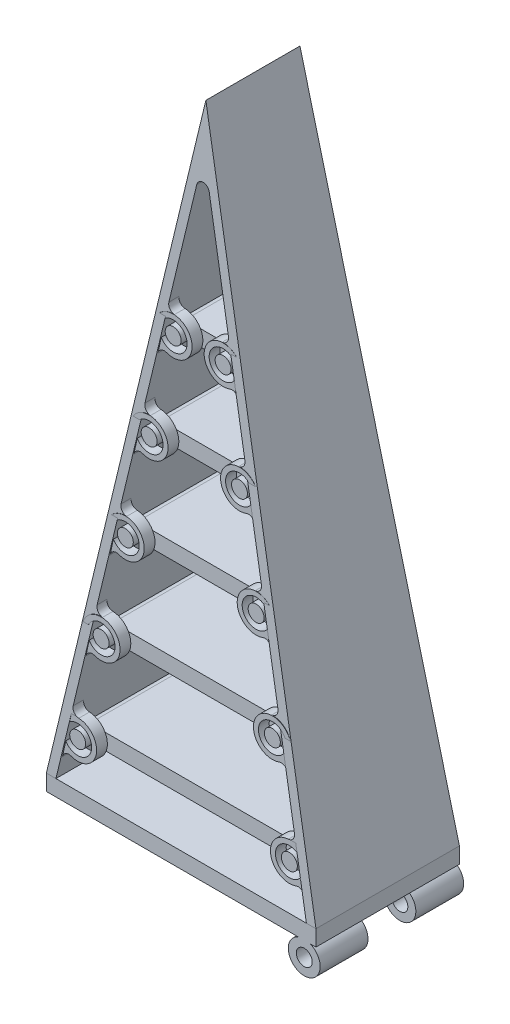
from build123d import *
from build123d.topology import SkipClean

# Parameters (mm, degrees)
AUFSATZ_LINEAR_AUSTRAGEN4_DEPTH      = 18
SCHNITT_LINEAR_AUSTRAGEN1_DEPTH      = 89.73537072
AUFSATZ_LINEAR_AUSTRAGEN5_DEPTH      = 5.37
AUFSATZ_LINEAR_AUSTRAGEN5_DEPTH_BACK = 5.37
AUFSATZ_LINEAR_AUSTRAGEN6_DEPTH      = 5.85
AUFSATZ_LINEAR_AUSTRAGEN6_DEPTH_BACK = 5.85
AUFSATZ_LINEAR_AUSTRAGEN7_DEPTH      = 6.3
AUFSATZ_LINEAR_AUSTRAGEN7_DEPTH_BACK = 6.3
AUFSATZ_LINEAR_AUSTRAGEN8_DEPTH      = 6.8
AUFSATZ_LINEAR_AUSTRAGEN8_DEPTH_BACK = 6.8
AUFSATZ_LINEAR_AUSTRAGEN9_DEPTH      = 7.2
AUFSATZ_LINEAR_AUSTRAGEN9_DEPTH_BACK = 7.2
SKIZZE13_R                           = 1
AUFSATZ_LINEAR_AUSTRAGEN12_DEPTH     = 1.5
SKIZZE14_R                           = 1
AUFSATZ_LINEAR_AUSTRAGEN13_DEPTH     = 1.5
SKIZZE15_R                           = 1
AUFSATZ_LINEAR_AUSTRAGEN14_DEPTH     = 1.5
SKIZZE16_R                           = 1
AUFSATZ_LINEAR_AUSTRAGEN15_DEPTH     = 1.5
SKIZZE17_R                           = 1
AUFSATZ_LINEAR_AUSTRAGEN16_DEPTH     = 1.5
SKIZZE18_R                           = 1
AUFSATZ_LINEAR_AUSTRAGEN17_DEPTH     = 1.5
SKIZZE19_R                           = 1
AUFSATZ_LINEAR_AUSTRAGEN18_DEPTH     = 1.5
SKIZZE20_R                           = 1
AUFSATZ_LINEAR_AUSTRAGEN19_DEPTH     = 1.5
SKIZZE21_R                           = 1
AUFSATZ_LINEAR_AUSTRAGEN20_DEPTH     = 1.5
SKIZZE22_R                           = 1
AUFSATZ_LINEAR_AUSTRAGEN21_DEPTH     = 1.5
SKIZZE24_R                           = 2.375
SKIZZE24_R_2                         = 1.75
AUFSATZ_LINEAR_AUSTRAGEN22_DEPTH     = 1.35
SKIZZE25_R                           = 2.375
SKIZZE25_R_2                         = 1.75
AUFSATZ_LINEAR_AUSTRAGEN23_DEPTH     = 1.35
SKIZZE26_R                           = 2.375
SKIZZE26_R_2                         = 1.75
AUFSATZ_LINEAR_AUSTRAGEN24_DEPTH     = 1.35
SKIZZE27_R                           = 2.375
SKIZZE27_R_2                         = 1.75
AUFSATZ_LINEAR_AUSTRAGEN25_DEPTH     = 1.35
SKIZZE28_R                           = 2.375
SKIZZE28_R_2                         = 1.75
AUFSATZ_LINEAR_AUSTRAGEN26_DEPTH     = 1.35
AUFSATZ_LINEAR_START                 = -1.35
SKIZZE29_R                           = 2.375
SKIZZE29_R_2                         = 1.75
AUFSATZ_LINEAR_AUSTRAGEN27_DEPTH     = 1.35
SKIZZE30_R                           = 2.375
SKIZZE30_R_2                         = 1.75
AUFSATZ_LINEAR_AUSTRAGEN28_DEPTH     = 1.35
SKIZZE31_R                           = 2.375
SKIZZE31_R_2                         = 1.75
AUFSATZ_LINEAR_AUSTRAGEN29_DEPTH     = 1.35
SKIZZE32_R                           = 2.375
SKIZZE32_R_2                         = 1.75
AUFSATZ_LINEAR_AUSTRAGEN30_DEPTH     = 1.35
SKIZZE33_R                           = 2.375
SKIZZE33_R_2                         = 1.75
AUFSATZ_LINEAR_AUSTRAGEN31_DEPTH     = 1.35
VERRUNDUNG1_R                        = 0.8
VERRUNDUNG2_R                        = 0.8
AUFSATZ_LINEAR_AUSTRAGEN32_DEPTH     = 2
SKIZZE38_R                           = 2
AUFSATZ_LINEAR_AUSTRAGEN33_DEPTH     = 18
SKIZZE39_R                           = 1
SCHNITT_LINEAR_AUSTRAGEN2_DEPTH      = 18
SCHNITT_LINEAR_START                 = -6
SKIZZE40_R                           = 2
SCHNITT_LINEAR_AUSTRAGEN3_DEPTH      = 6
SKIZZE42_R                           = 0.5
SCHNITT_LINEAR_AUSTRAGEN4_DEPTH      = 2
SKIZZE43_W                           = 25.348335875
SKIZZE43_H                           = 2.022346949
AUFSATZ_LINEAR_AUSTRAGEN34_DEPTH     = 2
VERRUNDUNG3_R                        = 1
SKIZZE44_R                           = 0.617602908
SCHNITT_LINEAR_AUSTRAGEN5_DEPTH      = 32
SKIZZE45_W                           = 1.002050024
SKIZZE45_H                           = 2.022346949
SKIZZE45_W_2                         = 0.677437189
AUFSATZ_LINEAR_AUSTRAGEN35_DEPTH     = 0.5


with BuildPart() as part:
    # Skizze1 → Aufsatz-Linear austragen4 (new body)
    with BuildSketch(Plane.XY):
        Polygon((0, 0), (16.911148858, -80), (15.711148858, -80), (0, -5.676728459), (-15.711148858, -80), (-16.911148858, -80), align=None)
    extrude(amount=AUFSATZ_LINEAR_AUSTRAGEN4_DEPTH)

    # Skizze11 → Schnitt-Linear austragen1 (cut, through all)
    with BuildSketch(Plane(origin=(17, 0, 0), x_dir=(0, 0, -1), z_dir=(1, 0, 0))):
        Polygon((-18, -80), (-14.9, 0), (-18, 0), align=None)
        Polygon((0, -80), (-3.1, 0), (0, 0), align=None)
    extrude(amount=-SCHNITT_LINEAR_AUSTRAGEN1_DEPTH, mode=Mode.SUBTRACT)

    # Skizze24 → Aufsatz-Linear austragen22 (add)
    # profile 1 of 2: a face of its own
    with BuildSketch(Plane.XY.offset(15.87)):
        with Locations((-3.132547008, -26.676728459)):
            Circle(SKIZZE24_R)
        with Locations((-3.132547008, -26.676728459)):
            Circle(SKIZZE24_R_2, mode=Mode.SUBTRACT)
    # profile 2 of 2: a face of its own
    with BuildSketch(Plane.XY.offset(15.87)):
        with Locations((3.132547008, -26.676728459)):
            Circle(SKIZZE24_R)
        with Locations((3.132547008, -26.676728459)):
            Circle(SKIZZE24_R_2, mode=Mode.SUBTRACT)
    extrude(amount=-AUFSATZ_LINEAR_AUSTRAGEN22_DEPTH)

    # Skizze25 → Aufsatz-Linear austragen23 (add)
    # profile 1 of 2: a face of its own
    with BuildSketch(Plane.XY.offset(16.35)):
        with Locations((-5.669219336, -38.676728459)):
            Circle(SKIZZE25_R)
        with Locations((-5.669219336, -38.676728459)):
            Circle(SKIZZE25_R_2, mode=Mode.SUBTRACT)
    # profile 2 of 2: a face of its own
    with BuildSketch(Plane.XY.offset(16.35)):
        with Locations((5.669219336, -38.676728459)):
            Circle(SKIZZE25_R)
        with Locations((5.669219336, -38.676728459)):
            Circle(SKIZZE25_R_2, mode=Mode.SUBTRACT)
    extrude(amount=-AUFSATZ_LINEAR_AUSTRAGEN23_DEPTH)

    # Skizze26 → Aufsatz-Linear austragen24 (add)
    # profile 1 of 2: a face of its own
    with BuildSketch(Plane.XY.offset(16.8)):
        with Locations((-8.205891665, -50.676728459)):
            Circle(SKIZZE26_R)
        with Locations((-8.205891665, -50.676728459)):
            Circle(SKIZZE26_R_2, mode=Mode.SUBTRACT)
    # profile 2 of 2: a face of its own
    with BuildSketch(Plane.XY.offset(16.8)):
        with Locations((8.205891665, -50.676728459)):
            Circle(SKIZZE26_R)
        with Locations((8.205891665, -50.676728459)):
            Circle(SKIZZE26_R_2, mode=Mode.SUBTRACT)
    extrude(amount=-AUFSATZ_LINEAR_AUSTRAGEN24_DEPTH)

    # Skizze27 → Aufsatz-Linear austragen25 (add)
    # profile 1 of 2: a face of its own
    with BuildSketch(Plane.XY.offset(17.3)):
        with Locations((-10.742563994, -62.676728459)):
            Circle(SKIZZE27_R)
        with Locations((-10.742563994, -62.676728459)):
            Circle(SKIZZE27_R_2, mode=Mode.SUBTRACT)
    # profile 2 of 2: a face of its own
    with BuildSketch(Plane.XY.offset(17.3)):
        with Locations((10.742563994, -62.676728459)):
            Circle(SKIZZE27_R)
        with Locations((10.742563994, -62.676728459)):
            Circle(SKIZZE27_R_2, mode=Mode.SUBTRACT)
    extrude(amount=-AUFSATZ_LINEAR_AUSTRAGEN25_DEPTH)

    # Skizze28 → Aufsatz-Linear austragen26 (add)
    # profile 1 of 2: a face of its own
    with BuildSketch(Plane.XY.offset(17.7)):
        with Locations((-13.279236322, -74.676728459)):
            Circle(SKIZZE28_R)
        with Locations((-13.279236322, -74.676728459)):
            Circle(SKIZZE28_R_2, mode=Mode.SUBTRACT)
    # profile 2 of 2: a face of its own
    with BuildSketch(Plane.XY.offset(17.7)):
        with Locations((13.279236322, -74.676728459)):
            Circle(SKIZZE28_R)
        with Locations((13.279236322, -74.676728459)):
            Circle(SKIZZE28_R_2, mode=Mode.SUBTRACT)
    extrude(amount=-AUFSATZ_LINEAR_AUSTRAGEN26_DEPTH)

    # Skizze29 → Aufsatz-Linear austragen27 (add)
    # profile 1 of 2: a face of its own
    with BuildSketch(Plane(origin=(0, 0, 2.13), x_dir=(-1, 0, 0), z_dir=(0, 0, -1)).offset(AUFSATZ_LINEAR_START)):
        with Locations((-3.132547008, -26.676728459)):
            Circle(SKIZZE29_R)
        with Locations((-3.132547008, -26.676728459)):
            Circle(SKIZZE29_R_2, mode=Mode.SUBTRACT)
    # profile 2 of 2: a face of its own
    with BuildSketch(Plane(origin=(0, 0, 2.13), x_dir=(-1, 0, 0), z_dir=(0, 0, -1)).offset(AUFSATZ_LINEAR_START)):
        with Locations((3.132547008, -26.676728459)):
            Circle(SKIZZE29_R)
        with Locations((3.132547008, -26.676728459)):
            Circle(SKIZZE29_R_2, mode=Mode.SUBTRACT)
    extrude(amount=AUFSATZ_LINEAR_AUSTRAGEN27_DEPTH)

    # Skizze30 → Aufsatz-Linear austragen28 (add)
    # profile 1 of 2: a face of its own
    with BuildSketch(Plane(origin=(0, 0, 1.65), x_dir=(-1, 0, 0), z_dir=(0, 0, -1)).offset(AUFSATZ_LINEAR_START)):
        with Locations((-5.669219336, -38.676728459)):
            Circle(SKIZZE30_R)
        with Locations((-5.669219336, -38.676728459)):
            Circle(SKIZZE30_R_2, mode=Mode.SUBTRACT)
    # profile 2 of 2: a face of its own
    with BuildSketch(Plane(origin=(0, 0, 1.65), x_dir=(-1, 0, 0), z_dir=(0, 0, -1)).offset(AUFSATZ_LINEAR_START)):
        with Locations((5.669219336, -38.676728459)):
            Circle(SKIZZE30_R)
        with Locations((5.669219336, -38.676728459)):
            Circle(SKIZZE30_R_2, mode=Mode.SUBTRACT)
    extrude(amount=AUFSATZ_LINEAR_AUSTRAGEN28_DEPTH)

    # Skizze31 → Aufsatz-Linear austragen29 (add)
    # profile 1 of 2: a face of its own
    with BuildSketch(Plane(origin=(0, 0, 1.2), x_dir=(-1, 0, 0), z_dir=(0, 0, -1)).offset(AUFSATZ_LINEAR_START)):
        with Locations((-8.205891665, -50.676728459)):
            Circle(SKIZZE31_R)
        with Locations((-8.205891665, -50.676728459)):
            Circle(SKIZZE31_R_2, mode=Mode.SUBTRACT)
    # profile 2 of 2: a face of its own
    with BuildSketch(Plane(origin=(0, 0, 1.2), x_dir=(-1, 0, 0), z_dir=(0, 0, -1)).offset(AUFSATZ_LINEAR_START)):
        with Locations((8.205891665, -50.676728459)):
            Circle(SKIZZE31_R)
        with Locations((8.205891665, -50.676728459)):
            Circle(SKIZZE31_R_2, mode=Mode.SUBTRACT)
    extrude(amount=AUFSATZ_LINEAR_AUSTRAGEN29_DEPTH)

    # Skizze32 → Aufsatz-Linear austragen30 (add)
    # profile 1 of 2: a face of its own
    with BuildSketch(Plane(origin=(0, 0, 0.7), x_dir=(-1, 0, 0), z_dir=(0, 0, -1)).offset(AUFSATZ_LINEAR_START)):
        with Locations((-10.742563994, -62.676728459)):
            Circle(SKIZZE32_R)
        with Locations((-10.742563994, -62.676728459)):
            Circle(SKIZZE32_R_2, mode=Mode.SUBTRACT)
    # profile 2 of 2: a face of its own
    with BuildSketch(Plane(origin=(0, 0, 0.7), x_dir=(-1, 0, 0), z_dir=(0, 0, -1)).offset(AUFSATZ_LINEAR_START)):
        with Locations((10.742563994, -62.676728459)):
            Circle(SKIZZE32_R)
        with Locations((10.742563994, -62.676728459)):
            Circle(SKIZZE32_R_2, mode=Mode.SUBTRACT)
    extrude(amount=AUFSATZ_LINEAR_AUSTRAGEN30_DEPTH)

    # Skizze33 → Aufsatz-Linear austragen31 (add)
    # profile 1 of 2: a face of its own
    with BuildSketch(Plane(origin=(0, 0, 0.3), x_dir=(-1, 0, 0), z_dir=(0, 0, -1)).offset(AUFSATZ_LINEAR_START)):
        with Locations((-13.279236322, -74.676728459)):
            Circle(SKIZZE33_R)
        with Locations((-13.279236322, -74.676728459)):
            Circle(SKIZZE33_R_2, mode=Mode.SUBTRACT)
    # profile 2 of 2: a face of its own
    with BuildSketch(Plane(origin=(0, 0, 0.3), x_dir=(-1, 0, 0), z_dir=(0, 0, -1)).offset(AUFSATZ_LINEAR_START)):
        with Locations((13.279236322, -74.676728459)):
            Circle(SKIZZE33_R)
        with Locations((13.279236322, -74.676728459)):
            Circle(SKIZZE33_R_2, mode=Mode.SUBTRACT)
    extrude(amount=AUFSATZ_LINEAR_AUSTRAGEN31_DEPTH)

    # Verrundung1
    verrundung1_edges = [part.edges().sort_by_distance(p)[0] for p in [
        (0, -5.676728459, 9),
    ]]
    fillet(verrundung1_edges, radius=VERRUNDUNG1_R)

    # Verrundung2
    # the kernel refuses this fillet: 0.8 mm, written as the material it adds along each edge
    with BuildSketch(Plane(origin=(-7.333926251, -40.370651683, 15), x_dir=(-0.20681895998091412, -0.9783792300495822, 0), z_dir=(0, 0, 1)), Plane(origin=(-9.87059858, -52.370651683, 15.45), x_dir=(-0.20681895998091412, -0.9783792300495822, 0), z_dir=(0, 0, 1)), Plane(origin=(-12.407270908, -64.370651683, 15.95), x_dir=(-0.2068189599809156, -0.9783792300495817, 0), z_dir=(0, 0, 1)), Plane(origin=(-14.943943237, -76.370651683, 16.35), x_dir=(-0.2068189599809131, -0.9783792300495824, 0), z_dir=(0, 0, 1)), Plane(origin=(-4.797253922, -28.370651683, 2.13), x_dir=(-0.20681895998091113, -0.9783792300495827, 0), z_dir=(0, 0, 1)), Plane(origin=(-7.333926251, -40.370651683, 1.65), x_dir=(-0.2068189599809139, -0.9783792300495822, 0), z_dir=(0, 0, 1)), Plane(origin=(-9.87059858, -52.370651683, 1.2), x_dir=(-0.20681895998091412, -0.9783792300495822, 0), z_dir=(0, 0, 1)), Plane(origin=(-12.407270908, -64.370651683, 0.7), x_dir=(-0.20681895998091412, -0.9783792300495822, 0), z_dir=(0, 0, 1)), Plane(origin=(-14.943943237, -76.370651683, 0.3), x_dir=(-0.2068189599809131, -0.9783792300495824, 0), z_dir=(0, 0, 1)), Plane(origin=(-4.797253922, -28.370651683, 14.52), x_dir=(-0.20681895998091177, -0.9783792300495826, 0), z_dir=(0, 0, 1))) as verrundung2_piece_1:
        with BuildLine():
            CenterArc((1.137162009, 0.8), VERRUNDUNG2_R, 171.334207831, 98.665792169)
            ThreePointArc((0.346294794, 0.920536499), (0.221320117, 0.44214625), (0, 0))
            Line((0, 0), (1.137162009, 0))
        make_face()
    extrude(amount=1.35)
    with BuildSketch(Plane(origin=(-6.505991795, -36.45401911, 15), x_dir=(0.20681895998091263, 0.9783792300495825, 0), z_dir=(0, 0, 1))) as verrundung2_piece_2_section:
        with BuildLine():
            CenterArc((1.137162009, -0.8), VERRUNDUNG2_R, 90, 98.665792169)
            ThreePointArc((0.346294794, -0.920536499), (0.221320117, -0.44214625), (0, 0))
            Line((0, 0), (1.137162009, 0))
        make_face()
    verrundung2_piece_2 = extrude(amount=4.155498263, mode=Mode.PRIVATE)
    verrundung2_piece_2 = split(verrundung2_piece_2, bisect_by=Plane(origin=(-6.217215771, -36.095589606, 16.298704097), z_dir=(0, -0.03872093994908253, -0.9992500632021294)), keep=Keep.TOP, mode=Mode.PRIVATE)
    add(verrundung2_piece_2)
    with BuildSketch(Plane(origin=(7.333926251, -40.370651683, 15), x_dir=(0.20681895998091462, -0.9783792300495819, 0), z_dir=(0, 0, 1)), Plane(origin=(9.87059858, -52.370651683, 15.45), x_dir=(0.20681895998091263, -0.9783792300495825, 0), z_dir=(0, 0, 1)), Plane(origin=(12.407270908, -64.370651683, 15.95), x_dir=(0.20681895998091412, -0.9783792300495822, 0), z_dir=(0, 0, 1)), Plane(origin=(14.943943237, -76.370651683, 16.35), x_dir=(0.20681895998090907, -0.9783792300495833, 0), z_dir=(0, 0, 1)), Plane(origin=(4.797253922, -28.370651683, 2.13), x_dir=(0.20681895998091462, -0.9783792300495819, 0), z_dir=(0, 0, 1)), Plane(origin=(7.333926251, -40.370651683, 1.65), x_dir=(0.20681895998091462, -0.9783792300495819, 0), z_dir=(0, 0, 1)), Plane(origin=(9.87059858, -52.370651683, 1.2), x_dir=(0.20681895998091412, -0.9783792300495822, 0), z_dir=(0, 0, 1)), Plane(origin=(12.407270908, -64.370651683, 0.7), x_dir=(0.20681895998091412, -0.9783792300495822, 0), z_dir=(0, 0, 1)), Plane(origin=(14.943943237, -76.370651683, 0.3), x_dir=(0.20681895998091113, -0.9783792300495827, 0), z_dir=(0, 0, 1)), Plane(origin=(4.797253922, -28.370651683, 14.52), x_dir=(0.20681895998091462, -0.9783792300495819, 0), z_dir=(0, 0, 1))) as verrundung2_piece_3:
        with BuildLine():
            CenterArc((1.137162009, -0.8), VERRUNDUNG2_R, 90, 98.665792169)
            ThreePointArc((0.346294794, -0.920536499), (0.221320117, -0.44214625), (0, 0))
            Line((0, 0), (1.137162009, 0))
        make_face()
    extrude(amount=1.35)
    with BuildSketch(Plane(origin=(6.505991795, -36.45401911, 15), x_dir=(-0.20681895998091487, 0.9783792300495819, 0), z_dir=(0, 0, 1))) as verrundung2_piece_4_section:
        with BuildLine():
            CenterArc((1.137162009, 0.8), VERRUNDUNG2_R, 171.334207831, 98.665792169)
            ThreePointArc((0.346294794, 0.920536499), (0.221320117, 0.44214625), (0, 0))
            Line((0, 0), (1.137162009, 0))
        make_face()
    verrundung2_piece_4 = extrude(amount=4.155498263, mode=Mode.PRIVATE)
    verrundung2_piece_4 = split(verrundung2_piece_4, bisect_by=Plane(origin=(6.217215771, -36.095589606, 16.298704097), z_dir=(0, -0.03872093994908253, -0.9992500632021294)), keep=Keep.TOP, mode=Mode.PRIVATE)
    add(verrundung2_piece_4)
    with BuildSketch(Plane(origin=(-9.042664124, -48.45401911, 15.45), x_dir=(0.20681895998091288, 0.9783792300495825, 0), z_dir=(0, 0, 1))) as verrundung2_piece_5_section:
        with BuildLine():
            CenterArc((1.137162009, -0.8), VERRUNDUNG2_R, 90, 98.665792169)
            ThreePointArc((0.346294794, -0.920536499), (0.221320117, -0.44214625), (0, 0))
            Line((0, 0), (1.137162009, 0))
        make_face()
    verrundung2_piece_5 = extrude(amount=4.170498263, mode=Mode.PRIVATE)
    verrundung2_piece_5 = split(verrundung2_piece_5, bisect_by=Plane(origin=(-8.753891259, -48.095283689, 16.763692243), z_dir=(0, -0.03872093994908253, -0.9992500632021294)), keep=Keep.TOP, mode=Mode.PRIVATE)
    add(verrundung2_piece_5)
    with BuildSketch(Plane(origin=(9.042664124, -48.45401911, 15.45), x_dir=(-0.2068189599809156, 0.9783792300495817, 0), z_dir=(0, 0, 1))) as verrundung2_piece_6_section:
        with BuildLine():
            CenterArc((1.137162009, 0.8), VERRUNDUNG2_R, 171.334207831, 98.665792169)
            ThreePointArc((0.346294794, 0.920536499), (0.221320117, 0.44214625), (0, 0))
            Line((0, 0), (1.137162009, 0))
        make_face()
    verrundung2_piece_6 = extrude(amount=4.170498263, mode=Mode.PRIVATE)
    verrundung2_piece_6 = split(verrundung2_piece_6, bisect_by=Plane(origin=(8.753891259, -48.095283689, 16.763692243), z_dir=(0, -0.03872093994908253, -0.9992500632021294)), keep=Keep.TOP, mode=Mode.PRIVATE)
    add(verrundung2_piece_6)
    with BuildSketch(Plane(origin=(-11.579336453, -60.45401911, 15.95), x_dir=(0.2068189599809101, 0.9783792300495829, 0), z_dir=(0, 0, 1))) as verrundung2_piece_7_section:
        with BuildLine():
            CenterArc((1.137162009, -0.8), VERRUNDUNG2_R, 90, 98.665792169)
            ThreePointArc((0.346294794, -0.920536499), (0.221320117, -0.44214625), (0, 0))
            Line((0, 0), (1.137162009, 0))
        make_face()
    verrundung2_piece_7 = extrude(amount=4.135498263, mode=Mode.PRIVATE)
    verrundung2_piece_7 = split(verrundung2_piece_7, bisect_by=Plane(origin=(-11.290556099, -60.095998069, 17.228719925), z_dir=(0, -0.03872093994908253, -0.9992500632021294)), keep=Keep.TOP, mode=Mode.PRIVATE)
    add(verrundung2_piece_7)
    with BuildSketch(Plane(origin=(11.579336453, -60.45401911, 15.95), x_dir=(-0.20681895998091435, 0.978379230049582, 0), z_dir=(0, 0, 1))) as verrundung2_piece_8_section:
        with BuildLine():
            CenterArc((1.137162009, 0.8), VERRUNDUNG2_R, 171.334207831, 98.665792169)
            ThreePointArc((0.346294794, 0.920536499), (0.221320117, 0.44214625), (0, 0))
            Line((0, 0), (1.137162009, 0))
        make_face()
    verrundung2_piece_8 = extrude(amount=4.135498263, mode=Mode.PRIVATE)
    verrundung2_piece_8 = split(verrundung2_piece_8, bisect_by=Plane(origin=(11.290556099, -60.095998069, 17.228719925), z_dir=(0, -0.03872093994908253, -0.9992500632021294)), keep=Keep.TOP, mode=Mode.PRIVATE)
    add(verrundung2_piece_8)
    with BuildSketch(Plane(origin=(-14.116008781, -72.45401911, 16.35), x_dir=(0.20681895998091412, 0.9783792300495822, 0), z_dir=(0, 0, 1))) as verrundung2_piece_9_section:
        with BuildLine():
            CenterArc((1.137162009, -0.8), VERRUNDUNG2_R, 90, 98.665792169)
            ThreePointArc((0.346294794, -0.920536499), (0.221320117, -0.44214625), (0, 0))
            Line((0, 0), (1.137162009, 0))
        make_face()
    verrundung2_piece_9 = extrude(amount=1.35, mode=Mode.PRIVATE)
    verrundung2_piece_9 = split(verrundung2_piece_9, bisect_by=Plane(origin=(-13.827218085, -72.094512866, 17.693662374), z_dir=(0, -0.03872093994908253, -0.9992500632021294)), keep=Keep.TOP, mode=Mode.PRIVATE)
    add(verrundung2_piece_9)
    with BuildSketch(Plane(origin=(14.116008781, -72.45401911, 16.35), x_dir=(-0.20681895998091662, 0.9783792300495815, 0), z_dir=(0, 0, 1))) as verrundung2_piece_10_section:
        with BuildLine():
            CenterArc((1.137162009, 0.8), VERRUNDUNG2_R, 171.334207831, 98.665792169)
            ThreePointArc((0.346294794, 0.920536499), (0.221320117, 0.44214625), (0, 0))
            Line((0, 0), (1.137162009, 0))
        make_face()
    verrundung2_piece_10 = extrude(amount=1.35, mode=Mode.PRIVATE)
    verrundung2_piece_10 = split(verrundung2_piece_10, bisect_by=Plane(origin=(13.827218085, -72.094512866, 17.693662374), z_dir=(0, -0.03872093994908253, -0.9992500632021294)), keep=Keep.TOP, mode=Mode.PRIVATE)
    add(verrundung2_piece_10)
    with BuildSketch(Plane(origin=(3.969319467, -24.45401911, -0.690498263), x_dir=(-0.20681895998091412, 0.9783792300495822, 0), z_dir=(0, 0, 1))) as verrundung2_piece_11_section:
        with BuildLine():
            CenterArc((1.137162009, 0.8), VERRUNDUNG2_R, 171.334207831, 98.665792169)
            ThreePointArc((0.346294794, 0.920536499), (0.221320117, 0.44214625), (0, 0))
            Line((0, 0), (1.137162009, 0))
        make_face()
    verrundung2_piece_11 = extrude(amount=4.170498263, mode=Mode.PRIVATE)
    verrundung2_piece_11 = split(verrundung2_piece_11, bisect_by=Plane(origin=(3.680546602, -24.095283689, 2.166307757), z_dir=(0, -0.03872093994908251, 0.9992500632021294)), keep=Keep.TOP, mode=Mode.PRIVATE)
    add(verrundung2_piece_11)
    with BuildSketch(Plane(origin=(-3.969319467, -24.45401911, -0.690498263), x_dir=(0.20681895998091285, 0.9783792300495823, 0), z_dir=(0, 0, 1))) as verrundung2_piece_12_section:
        with BuildLine():
            CenterArc((1.137162009, -0.8), VERRUNDUNG2_R, 90, 98.665792169)
            ThreePointArc((0.346294794, -0.920536499), (0.221320117, -0.44214625), (0, 0))
            Line((0, 0), (1.137162009, 0))
        make_face()
    verrundung2_piece_12 = extrude(amount=4.170498263, mode=Mode.PRIVATE)
    verrundung2_piece_12 = split(verrundung2_piece_12, bisect_by=Plane(origin=(-3.680546602, -24.095283689, 2.166307757), z_dir=(0, -0.03872093994908251, 0.9992500632021294)), keep=Keep.TOP, mode=Mode.PRIVATE)
    add(verrundung2_piece_12)
    with BuildSketch(Plane(origin=(6.505991795, -36.45401911, -1.155498263), x_dir=(-0.20681895998091537, 0.9783792300495818, 0), z_dir=(0, 0, 1))) as verrundung2_piece_13_section:
        with BuildLine():
            CenterArc((1.137162009, 0.8), VERRUNDUNG2_R, 171.334207831, 98.665792169)
            ThreePointArc((0.346294794, 0.920536499), (0.221320117, 0.44214625), (0, 0))
            Line((0, 0), (1.137162009, 0))
        make_face()
    verrundung2_piece_13 = extrude(amount=4.155498263, mode=Mode.PRIVATE)
    verrundung2_piece_13 = split(verrundung2_piece_13, bisect_by=Plane(origin=(6.217215771, -36.095589606, 1.701295903), z_dir=(0, -0.03872093994908251, 0.9992500632021294)), keep=Keep.TOP, mode=Mode.PRIVATE)
    add(verrundung2_piece_13)
    with BuildSketch(Plane(origin=(-6.505991795, -36.45401911, -1.155498263), x_dir=(0.20681895998091288, 0.9783792300495825, 0), z_dir=(0, 0, 1))) as verrundung2_piece_14_section:
        with BuildLine():
            CenterArc((1.137162009, -0.8), VERRUNDUNG2_R, 90, 98.665792169)
            ThreePointArc((0.346294794, -0.920536499), (0.221320117, -0.44214625), (0, 0))
            Line((0, 0), (1.137162009, 0))
        make_face()
    verrundung2_piece_14 = extrude(amount=4.155498263, mode=Mode.PRIVATE)
    verrundung2_piece_14 = split(verrundung2_piece_14, bisect_by=Plane(origin=(-6.217215771, -36.095589606, 1.701295903), z_dir=(0, -0.03872093994908251, 0.9992500632021294)), keep=Keep.TOP, mode=Mode.PRIVATE)
    add(verrundung2_piece_14)
    with BuildSketch(Plane(origin=(9.042664124, -48.45401911, -1.620498263), x_dir=(-0.20681895998091412, 0.9783792300495822, 0), z_dir=(0, 0, 1))) as verrundung2_piece_15_section:
        with BuildLine():
            CenterArc((1.137162009, 0.8), VERRUNDUNG2_R, 171.334207831, 98.665792169)
            ThreePointArc((0.346294794, 0.920536499), (0.221320117, 0.44214625), (0, 0))
            Line((0, 0), (1.137162009, 0))
        make_face()
    verrundung2_piece_15 = extrude(amount=4.170498263, mode=Mode.PRIVATE)
    verrundung2_piece_15 = split(verrundung2_piece_15, bisect_by=Plane(origin=(8.753891259, -48.095283689, 1.236307757), z_dir=(0, -0.03872093994908251, 0.9992500632021294)), keep=Keep.TOP, mode=Mode.PRIVATE)
    add(verrundung2_piece_15)
    with BuildSketch(Plane(origin=(-9.042664124, -48.45401911, -1.620498263), x_dir=(0.20681895998091263, 0.9783792300495825, 0), z_dir=(0, 0, 1))) as verrundung2_piece_16_section:
        with BuildLine():
            CenterArc((1.137162009, -0.8), VERRUNDUNG2_R, 90, 98.665792169)
            ThreePointArc((0.346294794, -0.920536499), (0.221320117, -0.44214625), (0, 0))
            Line((0, 0), (1.137162009, 0))
        make_face()
    verrundung2_piece_16 = extrude(amount=4.170498263, mode=Mode.PRIVATE)
    verrundung2_piece_16 = split(verrundung2_piece_16, bisect_by=Plane(origin=(-8.753891259, -48.095283689, 1.236307757), z_dir=(0, -0.03872093994908251, 0.9992500632021294)), keep=Keep.TOP, mode=Mode.PRIVATE)
    add(verrundung2_piece_16)
    with BuildSketch(Plane(origin=(11.579336453, -60.45401911, -2.085498263), x_dir=(-0.20681895998091412, 0.9783792300495822, 0), z_dir=(0, 0, 1))) as verrundung2_piece_17_section:
        with BuildLine():
            CenterArc((1.137162009, 0.8), VERRUNDUNG2_R, 171.334207831, 98.665792169)
            ThreePointArc((0.346294794, 0.920536499), (0.221320117, 0.44214625), (0, 0))
            Line((0, 0), (1.137162009, 0))
        make_face()
    verrundung2_piece_17 = extrude(amount=4.135498263, mode=Mode.PRIVATE)
    verrundung2_piece_17 = split(verrundung2_piece_17, bisect_by=Plane(origin=(11.290556099, -60.095998069, 0.771280075), z_dir=(0, -0.03872093994908251, 0.9992500632021294)), keep=Keep.TOP, mode=Mode.PRIVATE)
    add(verrundung2_piece_17)
    with BuildSketch(Plane(origin=(-11.579336453, -60.45401911, -2.085498263), x_dir=(0.2068189599809131, 0.9783792300495824, 0), z_dir=(0, 0, 1))) as verrundung2_piece_18_section:
        with BuildLine():
            CenterArc((1.137162009, -0.8), VERRUNDUNG2_R, 90, 98.665792169)
            ThreePointArc((0.346294794, -0.920536499), (0.221320117, -0.44214625), (0, 0))
            Line((0, 0), (1.137162009, 0))
        make_face()
    verrundung2_piece_18 = extrude(amount=4.135498263, mode=Mode.PRIVATE)
    verrundung2_piece_18 = split(verrundung2_piece_18, bisect_by=Plane(origin=(-11.290556099, -60.095998069, 0.771280075), z_dir=(0, -0.03872093994908251, 0.9992500632021294)), keep=Keep.TOP, mode=Mode.PRIVATE)
    add(verrundung2_piece_18)
    with BuildSketch(Plane(origin=(14.116008781, -72.45401911, 0.3), x_dir=(-0.2068189599809156, 0.9783792300495817, 0), z_dir=(0, 0, 1))) as verrundung2_piece_19_section:
        with BuildLine():
            CenterArc((1.137162009, 0.8), VERRUNDUNG2_R, 171.334207831, 98.665792169)
            ThreePointArc((0.346294794, 0.920536499), (0.221320117, 0.44214625), (0, 0))
            Line((0, 0), (1.137162009, 0))
        make_face()
    verrundung2_piece_19 = extrude(amount=1.35, mode=Mode.PRIVATE)
    verrundung2_piece_19 = split(verrundung2_piece_19, bisect_by=Plane(origin=(13.827218085, -72.094512866, 0.306337626), z_dir=(0, -0.03872093994908251, 0.9992500632021294)), keep=Keep.TOP, mode=Mode.PRIVATE)
    add(verrundung2_piece_19)
    with BuildSketch(Plane(origin=(-14.116008781, -72.45401911, 0.3), x_dir=(0.20681895998091412, 0.9783792300495822, 0), z_dir=(0, 0, 1))) as verrundung2_piece_20_section:
        with BuildLine():
            CenterArc((1.137162009, -0.8), VERRUNDUNG2_R, 90, 98.665792169)
            ThreePointArc((0.346294794, -0.920536499), (0.221320117, -0.44214625), (0, 0))
            Line((0, 0), (1.137162009, 0))
        make_face()
    verrundung2_piece_20 = extrude(amount=1.35, mode=Mode.PRIVATE)
    verrundung2_piece_20 = split(verrundung2_piece_20, bisect_by=Plane(origin=(-13.827218085, -72.094512866, 0.306337626), z_dir=(0, -0.03872093994908251, 0.9992500632021294)), keep=Keep.TOP, mode=Mode.PRIVATE)
    add(verrundung2_piece_20)
    with BuildSketch(Plane(origin=(-3.969319467, -24.45401911, 14.52), x_dir=(0.20681895998091399, 0.978379230049582, 0), z_dir=(0, 0, 1))) as verrundung2_piece_21_section:
        with BuildLine():
            CenterArc((1.137162009, -0.8), VERRUNDUNG2_R, 90, 98.665792169)
            ThreePointArc((0.346294794, -0.920536499), (0.221320117, -0.44214625), (0, 0))
            Line((0, 0), (1.137162009, 0))
        make_face()
    verrundung2_piece_21 = extrude(amount=4.170498263, mode=Mode.PRIVATE)
    verrundung2_piece_21 = split(verrundung2_piece_21, bisect_by=Plane(origin=(-3.680546602, -24.095283689, 15.833692243), z_dir=(0, -0.03872093994908253, -0.9992500632021294)), keep=Keep.TOP, mode=Mode.PRIVATE)
    add(verrundung2_piece_21)
    with BuildSketch(Plane(origin=(3.969319467, -24.45401911, 14.52), x_dir=(-0.20681895998091487, 0.9783792300495819, 0), z_dir=(0, 0, 1))) as verrundung2_piece_22_section:
        with BuildLine():
            CenterArc((1.137162009, 0.8), VERRUNDUNG2_R, 171.334207831, 98.665792169)
            ThreePointArc((0.346294794, 0.920536499), (0.221320117, 0.44214625), (0, 0))
            Line((0, 0), (1.137162009, 0))
        make_face()
    verrundung2_piece_22 = extrude(amount=4.170498263, mode=Mode.PRIVATE)
    verrundung2_piece_22 = split(verrundung2_piece_22, bisect_by=Plane(origin=(3.680546602, -24.095283689, 15.833692243), z_dir=(0, -0.03872093994908253, -0.9992500632021294)), keep=Keep.TOP, mode=Mode.PRIVATE)
    add(verrundung2_piece_22)

    # Skizze37 → Aufsatz-Linear austragen32 (add)
    with BuildSketch(Plane.XZ.offset(80)):
        Polygon((-16.911148858, 0), (-15.711148858, 0), (16.911148858, 0), (16.911148858, 18), (-16.911148858, 18), align=None)
    extrude(amount=AUFSATZ_LINEAR_AUSTRAGEN32_DEPTH)

    # Skizze38 → Aufsatz-Linear austragen33 (add)
    with BuildSketch(Plane.XY.offset(18)):
        with Locations((15.441377829, -83.85395926)):
            Circle(SKIZZE38_R)
    extrude(amount=-AUFSATZ_LINEAR_AUSTRAGEN33_DEPTH)

    # Skizze39 → Schnitt-Linear austragen2 (cut)
    with BuildSketch(Plane.XY.offset(18)):
        with Locations((15.441377829, -83.85395926)):
            Circle(SKIZZE39_R)
    extrude(amount=-SCHNITT_LINEAR_AUSTRAGEN2_DEPTH, mode=Mode.SUBTRACT)

    # Skizze40 → Schnitt-Linear austragen3 (cut)
    with BuildSketch(Plane.XY.offset(18).offset(SCHNITT_LINEAR_START)):
        with Locations((15.441377829, -83.85395926)):
            Circle(SKIZZE40_R)
    extrude(amount=-SCHNITT_LINEAR_AUSTRAGEN3_DEPTH, mode=Mode.SUBTRACT)

    # Skizze42 → Schnitt-Linear austragen4 (cut)
    with BuildSketch(Plane.XZ.offset(82)):
        with Locations(Location((-14.549729588, 9.293904983, 0), (0, 0, 270))):
            Circle(SKIZZE42_R)
    extrude(amount=-SCHNITT_LINEAR_AUSTRAGEN4_DEPTH, mode=Mode.SUBTRACT)

    # Skizze43 → Aufsatz-Linear austragen34 (add)
    with BuildSketch(Plane.XZ.offset(82)):
        with Locations((-1.293751038, 9.362190777)):
            Rectangle(SKIZZE43_W, SKIZZE43_H)
    extrude(amount=AUFSATZ_LINEAR_AUSTRAGEN34_DEPTH)

    # Verrundung3
    verrundung3_edges = [part.edges().sort_by_distance(p)[0] for p in [
        (-13.967918976, -84, 9.362190776),
    ]]
    fillet(verrundung3_edges, radius=VERRUNDUNG3_R)

    # Skizze44 → Schnitt-Linear austragen5 (cut)
    with BuildSketch(Plane(origin=(11.380416899, 0, 0), x_dir=(0, 0, -1), z_dir=(1, 0, 0))):
        with Locations((-9.362190776, -84)):
            Circle(SKIZZE44_R)
    extrude(amount=-SCHNITT_LINEAR_AUSTRAGEN5_DEPTH, mode=Mode.SUBTRACT)

    # Skizze45 → Aufsatz-Linear austragen35 (add)
    with BuildSketch(Plane.XZ.offset(84)):
        with Locations((-12.466893964, 9.362190777)):
            Rectangle(SKIZZE45_W, SKIZZE45_H)
        with Locations((8.863925715, 9.362190777)):
            Rectangle(SKIZZE45_W_2, SKIZZE45_H)
    extrude(amount=AUFSATZ_LINEAR_AUSTRAGEN35_DEPTH)


with BuildPart() as body_2:
    # Skizze6 → Aufsatz-Linear austragen5 (new, two sides: drawn at the far end of the back side and taken through both)
    with BuildSketch(Plane.XY.offset(9).offset(-AUFSATZ_LINEAR_AUSTRAGEN5_DEPTH_BACK)):
        with BuildLine():
            Line((3.132547008, -25.676728459), (-3.132547008, -25.676728459))
            ThreePointArc((-3.132547008, -25.676728459), (-4.132547008, -26.676728459), (-3.132547008, -27.676728459))
            Line((-3.132547008, -27.676728459), (3.132547008, -27.676728459))
            ThreePointArc((3.132547008, -27.676728459), (4.132547008, -26.676728459), (3.132547008, -25.676728459))
        make_face()
    extrude(amount=AUFSATZ_LINEAR_AUSTRAGEN5_DEPTH + AUFSATZ_LINEAR_AUSTRAGEN5_DEPTH_BACK)

    # Skizze13 → Aufsatz-Linear austragen12 (add)
    with BuildSketch(Plane.XY.offset(14.37)):
        with Locations((-3.132547008, -26.676728459)):
            Circle(SKIZZE13_R)
        with Locations((3.132547008, -26.676728459)):
            Circle(SKIZZE13_R)
    extrude(amount=AUFSATZ_LINEAR_AUSTRAGEN12_DEPTH)

    # Skizze18 → Aufsatz-Linear austragen17 (add)
    with SkipClean():  # the faces are left unmerged after this step: merging them gives an invalid solid
        with BuildSketch(Plane(origin=(0, 0, 3.63), x_dir=(-1, 0, 0), z_dir=(0, 0, -1))):
            with Locations(Location((-3.132547008, -26.676728459, 0), (0, 0, 180))):
                Circle(SKIZZE18_R)
            with Locations(Location((3.132547008, -26.676728459, 0), (0, 0, 180))):
                Circle(SKIZZE18_R)
        extrude(amount=AUFSATZ_LINEAR_AUSTRAGEN17_DEPTH)


with BuildPart() as body_3:
    # Skizze7 → Aufsatz-Linear austragen6 (new, two sides: drawn at the far end of the back side and taken through both)
    with BuildSketch(Plane.XY.offset(9).offset(-AUFSATZ_LINEAR_AUSTRAGEN6_DEPTH_BACK)):
        with BuildLine():
            Line((5.669219336, -37.676728459), (-5.669219336, -37.676728459))
            ThreePointArc((-5.669219336, -37.676728459), (-6.669219336, -38.676728459), (-5.669219336, -39.676728459))
            Line((-5.669219336, -39.676728459), (5.669219336, -39.676728459))
            ThreePointArc((5.669219336, -39.676728459), (6.669219336, -38.676728459), (5.669219336, -37.676728459))
        make_face()
    extrude(amount=AUFSATZ_LINEAR_AUSTRAGEN6_DEPTH + AUFSATZ_LINEAR_AUSTRAGEN6_DEPTH_BACK)

    # Skizze14 → Aufsatz-Linear austragen13 (add)
    with BuildSketch(Plane.XY.offset(14.85)):
        with Locations((-5.669219336, -38.676728459)):
            Circle(SKIZZE14_R)
        with Locations((5.669219336, -38.676728459)):
            Circle(SKIZZE14_R)
    extrude(amount=AUFSATZ_LINEAR_AUSTRAGEN13_DEPTH)

    # Skizze19 → Aufsatz-Linear austragen18 (add)
    with SkipClean():  # the faces are left unmerged after this step: merging them gives an invalid solid
        with BuildSketch(Plane(origin=(0, 0, 3.15), x_dir=(-1, 0, 0), z_dir=(0, 0, -1))):
            with Locations(Location((-5.669219336, -38.676728459, 0), (0, 0, 180))):
                Circle(SKIZZE19_R)
            with Locations(Location((5.669219336, -38.676728459, 0), (0, 0, 180))):
                Circle(SKIZZE19_R)
        extrude(amount=AUFSATZ_LINEAR_AUSTRAGEN18_DEPTH)


with BuildPart() as body_4:
    # Skizze8 → Aufsatz-Linear austragen7 (new, two sides: drawn at the far end of the back side and taken through both)
    with BuildSketch(Plane.XY.offset(9).offset(-AUFSATZ_LINEAR_AUSTRAGEN7_DEPTH_BACK)):
        with BuildLine():
            Line((8.205891665, -49.676728459), (-8.205891665, -49.676728459))
            ThreePointArc((-8.205891665, -49.676728459), (-9.205891665, -50.676728459), (-8.205891665, -51.676728459))
            Line((-8.205891665, -51.676728459), (8.205891665, -51.676728459))
            ThreePointArc((8.205891665, -51.676728459), (9.205891665, -50.676728459), (8.205891665, -49.676728459))
        make_face()
    extrude(amount=AUFSATZ_LINEAR_AUSTRAGEN7_DEPTH + AUFSATZ_LINEAR_AUSTRAGEN7_DEPTH_BACK)

    # Skizze15 → Aufsatz-Linear austragen14 (add)
    with BuildSketch(Plane.XY.offset(15.3)):
        with Locations((-8.205891665, -50.676728459)):
            Circle(SKIZZE15_R)
        with Locations((8.205891665, -50.676728459)):
            Circle(SKIZZE15_R)
    extrude(amount=AUFSATZ_LINEAR_AUSTRAGEN14_DEPTH)

    # Skizze20 → Aufsatz-Linear austragen19 (add)
    with BuildSketch(Plane(origin=(0, 0, 2.7), x_dir=(-1, 0, 0), z_dir=(0, 0, -1))):
        with Locations(Location((-8.205891665, -50.676728459, 0), (0, 0, 180))):
            Circle(SKIZZE20_R)
        with Locations(Location((8.205891665, -50.676728459, 0), (0, 0, 180))):
            Circle(SKIZZE20_R)
    extrude(amount=AUFSATZ_LINEAR_AUSTRAGEN19_DEPTH)


with BuildPart() as body_5:
    # Skizze9 → Aufsatz-Linear austragen8 (new, two sides: drawn at the far end of the back side and taken through both)
    with BuildSketch(Plane.XY.offset(9).offset(-AUFSATZ_LINEAR_AUSTRAGEN8_DEPTH_BACK)):
        with BuildLine():
            Line((10.742563994, -61.676728459), (-10.742563994, -61.676728459))
            ThreePointArc((-10.742563994, -61.676728459), (-11.742563994, -62.676728459), (-10.742563994, -63.676728459))
            Line((-10.742563994, -63.676728459), (10.742563994, -63.676728459))
            ThreePointArc((10.742563994, -63.676728459), (11.742563994, -62.676728459), (10.742563994, -61.676728459))
        make_face()
    extrude(amount=AUFSATZ_LINEAR_AUSTRAGEN8_DEPTH + AUFSATZ_LINEAR_AUSTRAGEN8_DEPTH_BACK)

    # Skizze16 → Aufsatz-Linear austragen15 (add)
    with BuildSketch(Plane.XY.offset(15.8)):
        with Locations((-10.742563994, -62.676728459)):
            Circle(SKIZZE16_R)
        with Locations((10.742563994, -62.676728459)):
            Circle(SKIZZE16_R)
    extrude(amount=AUFSATZ_LINEAR_AUSTRAGEN15_DEPTH)

    # Skizze21 → Aufsatz-Linear austragen20 (add)
    with BuildSketch(Plane(origin=(0, 0, 2.2), x_dir=(-1, 0, 0), z_dir=(0, 0, -1))):
        with Locations(Location((-10.742563994, -62.676728459, 0), (0, 0, 180))):
            Circle(SKIZZE21_R)
        with Locations(Location((10.742563994, -62.676728459, 0), (0, 0, 180))):
            Circle(SKIZZE21_R)
    extrude(amount=AUFSATZ_LINEAR_AUSTRAGEN20_DEPTH)


with BuildPart() as body_6:
    # Skizze10 → Aufsatz-Linear austragen9 (new, two sides: drawn at the far end of the back side and taken through both)
    with BuildSketch(Plane.XY.offset(9).offset(-AUFSATZ_LINEAR_AUSTRAGEN9_DEPTH_BACK)):
        with BuildLine():
            Line((13.279236322, -73.676728459), (-13.279236322, -73.676728459))
            ThreePointArc((-13.279236322, -73.676728459), (-14.279236322, -74.676728459), (-13.279236322, -75.676728459))
            Line((-13.279236322, -75.676728459), (13.279236322, -75.676728459))
            ThreePointArc((13.279236322, -75.676728459), (14.279236322, -74.676728459), (13.279236322, -73.676728459))
        make_face()
    extrude(amount=AUFSATZ_LINEAR_AUSTRAGEN9_DEPTH + AUFSATZ_LINEAR_AUSTRAGEN9_DEPTH_BACK)

    # Skizze17 → Aufsatz-Linear austragen16 (add)
    with BuildSketch(Plane.XY.offset(16.2)):
        with Locations((-13.279236322, -74.676728459)):
            Circle(SKIZZE17_R)
        with Locations((13.279236322, -74.676728459)):
            Circle(SKIZZE17_R)
    extrude(amount=AUFSATZ_LINEAR_AUSTRAGEN16_DEPTH)

    # Skizze22 → Aufsatz-Linear austragen21 (add)
    with SkipClean():  # the faces are left unmerged after this step: merging them gives an invalid solid
        with BuildSketch(Plane(origin=(0, 0, 1.8), x_dir=(-1, 0, 0), z_dir=(0, 0, -1))):
            with Locations(Location((-13.279236322, -74.676728459, 0), (0, 0, 180))):
                Circle(SKIZZE22_R)
            with Locations(Location((13.279236322, -74.676728459, 0), (0, 0, 180))):
                Circle(SKIZZE22_R)
        extrude(amount=AUFSATZ_LINEAR_AUSTRAGEN21_DEPTH)


solid = Compound([part.part, body_2.part, body_3.part, body_4.part, body_5.part, body_6.part])
